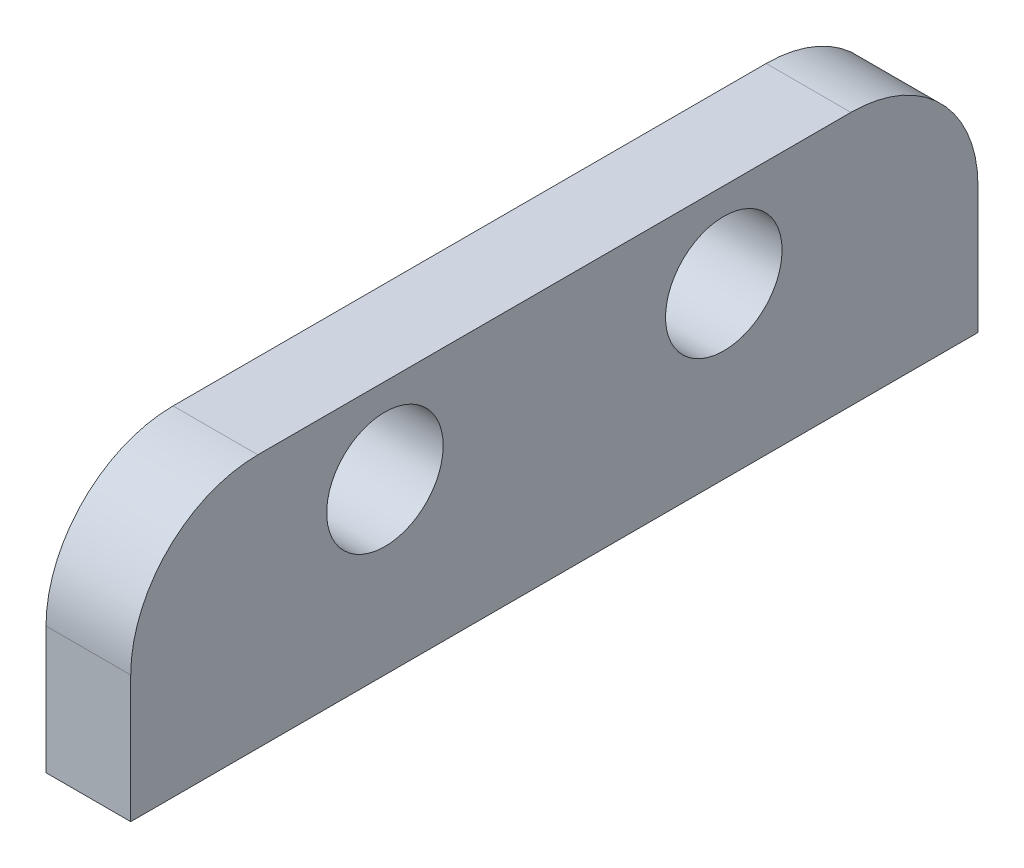
from build123d import *

# Parameters (mm, degrees)
SKETCH1_W           = 40
SKETCH1_H           = 12
SKETCH1_R           = 2.75
BOSS_EXTRUDE1_DEPTH = 4
FILLET1_R           = 6


with BuildPart() as part:
    # Sketch1 → Boss-Extrude1 (new body)
    with BuildSketch(Plane(origin=(0, 0, 0), x_dir=(0, 0, -1), z_dir=(1, 0, 0))):
        Rectangle(SKETCH1_W, SKETCH1_H)
        with Locations((-8, 2)):
            Circle(SKETCH1_R, mode=Mode.SUBTRACT)
        with Locations((8, 2)):
            Circle(SKETCH1_R, mode=Mode.SUBTRACT)
    extrude(amount=BOSS_EXTRUDE1_DEPTH)

    # Fillet1
    fillet1_edges = [part.edges().sort_by_distance(p)[0] for p in [
        (2, 6, 20),
        (2, 6, -20),
    ]]
    fillet(fillet1_edges, radius=FILLET1_R)


solid = part.part
